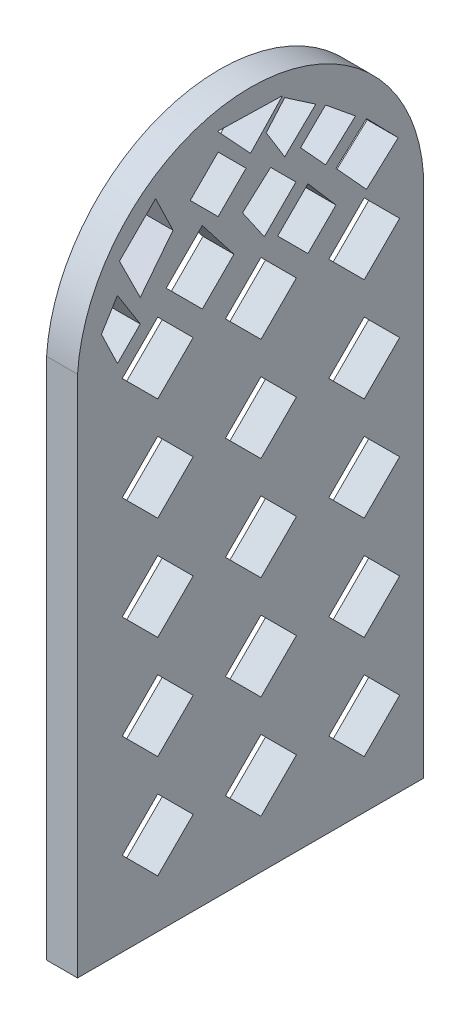
from build123d import *

# Parameters (mm, degrees)
MAINBASESKETCH_W                 = 7.9
MAINBASESKETCH_H                 = 3.2
MAINBASEEXTRUDE_DEPTH            = 7.9
MAINBASESHELL_T                  = -1.2
SLIMYELLOWUNDEREXT_START         = -0.2
SLIMYELLOWUNDEREXT_DEPTH         = 2
SLIMYELLLOWUPPERCIRCLESKETCH_R   = 2.45
SLIMYELLLOWUPPERCIRCLESKETCH_R_2 = 2
SLIMYELLOWUPPERCIRCLE_DEPTH      = 1.6
MOVE_START                       = 3.2
MOVE_FACE2_OUTLINE_W             = 7.9
MOVE_FACE2_OUTLINE_H             = 15.8
MOVE_FACE2_OUTLINE_R             = 2
MOVE_FACE2_DEPTH                 = 27.8
MOVE_START_2                     = 31
MOVE_FACE2_2_OUTLINE_R           = 2.45
MOVE_FACE2_2_OUTLINE_R_2         = 2
MOVE_FACE2_2_DEPTH               = 1.6
FILLET25_R                       = 7.6
FILLET26_R                       = 7.6
CUT_EXTRUDE55_DEPTH              = 35.461282763
CUT_EXTRUDE57_REACH              = 34.748
SKETCH160_R                      = 0.75
BOSS_EXTRUDE20_DEPTH             = 3.5
BOSS_EXTRUDE22_DEPTH             = 1.2
CUT_EXTRUDE58_DEPTH              = 35.461282763
CUT_EXTRUDE59_DEPTH              = 31.506685799
CUT_EXTRUDE61_DEPTH              = 31.506685799
LPATTERN5_COUNT                  = 5
LPATTERN5_PITCH                  = 4
LPATTERN5_COUNT_DIR2             = 3
LPATTERN5_PITCH_DIR2             = 4
CUT_EXTRUDE62_DEPTH              = 31.506685799


# Read off the part's stored shape, not the designer's step: Move Face2
with BuildPart() as part:
    # MainBaseSketch → MainBaseExtrude (new, symmetric)
    with BuildSketch(Plane.XY):
        with Locations((4.631967213, 1.6)):
            Rectangle(MAINBASESKETCH_W, MAINBASESKETCH_H)
    extrude(amount=MAINBASEEXTRUDE_DEPTH, both=True)

    # MainBaseShell
    mainbaseshell_openings = [part.faces().sort_by_distance(p)[0] for p in [
        (4.631967213, 0, 0),
    ]]
    offset(amount=MAINBASESHELL_T, openings=mainbaseshell_openings, kind=Kind.INTERSECTION)

    # SlimYellowUnderExtSketch → SlimYellowUnderExt (add)
    with BuildSketch(Plane.XZ.offset(-2).offset(SLIMYELLOWUNDEREXT_START)):
        Polygon((1.881967213, 1.952811318), (1.881967213, 2.947188682), (2.384104441, 2.947188682), (2.882626102, 2.45), (2.384104441, 1.952811318), align=None)
        Polygon((6.381308324, 2.45), (6.879829986, 2.947188682), (7.381967213, 2.947188682), (7.381967213, 1.952811318), (6.879829986, 1.952811318), align=None)
        Polygon((1.881967213, -1.952811318), (2.384104441, -1.952811318), (2.882626102, -2.45), (2.384104441, -2.947188682), (1.881967213, -2.947188682), align=None)
        Polygon((7.381967213, -1.952811318), (7.381967213, -2.947188682), (6.879829986, -2.947188682), (6.381308324, -2.45), (6.879829986, -1.952811318), align=None)
    extrude(amount=SLIMYELLOWUNDEREXT_DEPTH)

    # SlimYelllowUpperCircleSketch → SlimYellowUpperCircle (add)
    with BuildSketch(Plane(origin=(0, 3.2, 0), x_dir=(1, 0, 0), z_dir=(0, 1, 0))):
        with Locations((4.647335619, 0)):
            Circle(SLIMYELLLOWUPPERCIRCLESKETCH_R)
        with Locations(Location((4.647335619, 0, 0), (0, 0, 270))):
            Circle(SLIMYELLLOWUPPERCIRCLESKETCH_R_2, mode=Mode.SUBTRACT)
    extrude(amount=SLIMYELLOWUPPERCIRCLE_DEPTH)

    # Move Face2 outline → Move Face2 (add)
    with BuildSketch(Plane(origin=(0, 0, 0), x_dir=(1, 0, 0), z_dir=(0, 1, 0)).offset(MOVE_START)):
        with Locations((4.631967213, 0)):
            Rectangle(MOVE_FACE2_OUTLINE_W, MOVE_FACE2_OUTLINE_H)
        with Locations((4.647335619, 0)):
            Circle(MOVE_FACE2_OUTLINE_R, mode=Mode.SUBTRACT)
    extrude(amount=MOVE_FACE2_DEPTH)

    # Move Face2 2 outline → Move Face2 2 (add)
    with BuildSketch(Plane(origin=(0, 0, 0), x_dir=(1, 0, 0), z_dir=(0, 1, 0)).offset(MOVE_START_2)):
        with Locations((4.647335619, 0)):
            Circle(MOVE_FACE2_2_OUTLINE_R)
        with Locations((4.647335619, 0)):
            Circle(MOVE_FACE2_2_OUTLINE_R_2, mode=Mode.SUBTRACT)
    extrude(amount=MOVE_FACE2_2_DEPTH)

    # Fillet25
    # the kernel refuses this fillet: 7.6 mm, written as the material it takes off along each edge
    with BuildSketch(Plane(origin=(0.681967213, 31, 7.9), x_dir=(0, 0, -1), z_dir=(1, 0, 0))) as fillet25_piece_1_section:
        with BuildLine():
            CenterArc((FILLET25_R, -FILLET25_R), FILLET25_R, 90, 90)
            Line((0, -FILLET25_R), (-FILLET25_R * 0.02, -FILLET25_R))
            Line((-FILLET25_R * 0.02, -FILLET25_R), (-FILLET25_R * 0.02, FILLET25_R * 0.02))
            Line((-FILLET25_R * 0.02, FILLET25_R * 0.02), (FILLET25_R, FILLET25_R * 0.02))
            Line((FILLET25_R, FILLET25_R * 0.02), (FILLET25_R, 0))
        make_face()
    fillet25_piece_1 = extrude(amount=7.9, mode=Mode.PRIVATE)
    fillet25_piece_1 = fillet25_piece_1 - Plane(origin=(4.647335619, 29.251763141, 0), x_dir=(1, 0, 0), z_dir=(0, -1, 0)) * Cylinder(2.45, 47, mode=Mode.PRIVATE)
    add(fillet25_piece_1, mode=Mode.SUBTRACT)

    # Fillet26
    # the kernel refuses this fillet: 7.6 mm, written as the material it takes off along each edge
    with BuildSketch(Plane(origin=(27.581967213, 31, -7.9), x_dir=(0, 0, 1), z_dir=(-1, 0, 0))) as fillet26_piece_1_section:
        with BuildLine():
            CenterArc((FILLET26_R, -FILLET26_R), FILLET26_R, 90, 90)
            Line((0, -FILLET26_R), (0, 0))
            Line((0, 0), (FILLET26_R, 0))
        make_face()
    fillet26_piece_1 = extrude(amount=45.9, mode=Mode.PRIVATE)
    fillet26_piece_1 = fillet26_piece_1 - Plane(origin=(4.647335619, 29.29236393, 0), x_dir=(1, 0, 0), z_dir=(0, -1, 0)) * Cylinder(2.45, 123, mode=Mode.PRIVATE)
    add(fillet26_piece_1, mode=Mode.SUBTRACT)

    # Sketch159 → Cut-Extrude55 (cut, through all)
    with BuildSketch(Plane(origin=(8.581967213, 0, 0), x_dir=(0, 0, -1), z_dir=(1, 0, 0))):
        with BuildLine():
            Line((6.7, 3.204620212), (6.7, 23.463811934))
            ThreePointArc((6.7, 23.463811934), (0, 29.737650856), (-6.7, 23.463811934))
            Line((-6.7, 23.463811934), (-6.7, 3.204620212))
            Line((-6.7, 3.204620212), (6.7, 3.204620212))
        make_face()
    extrude(amount=-CUT_EXTRUDE55_DEPTH, mode=Mode.SUBTRACT)

    # Sketch160 → Cut-Extrude57 (cut, up to next)
    with BuildSketch(Plane(origin=(0, 2, 0), x_dir=(-1, 0, 0), z_dir=(0, -1, 0)), mode=Mode.PRIVATE) as cut_extrude57_sk1:
        with Locations(Location((-6.381967213, 0, 0), (0, 0, 180))):
            Circle(SKETCH160_R)
    cut_extrude57_tool1 = extrude(cut_extrude57_sk1.sketch, amount=-CUT_EXTRUDE57_REACH, mode=Mode.PRIVATE) & part.part
    # Sketch160 → Cut-Extrude57 (cut, up to next)
    with BuildSketch(Plane(origin=(0, 2, 0), x_dir=(-1, 0, 0), z_dir=(0, -1, 0)), mode=Mode.PRIVATE) as cut_extrude57_sk2:
        with Locations(Location((-2.881967213, 0, 0), (0, 0, 180))):
            Circle(SKETCH160_R)
    cut_extrude57_tool2 = extrude(cut_extrude57_sk2.sketch, amount=-CUT_EXTRUDE57_REACH, mode=Mode.PRIVATE) & part.part
    add(cut_extrude57_tool1.solids().sort_by_distance((6.381967, 2, 0))[0], mode=Mode.SUBTRACT)
    add(cut_extrude57_tool2.solids().sort_by_distance((2.881967, 2, 0))[0], mode=Mode.SUBTRACT)

    # Sketch161 → Boss-Extrude20 (add, symmetric)
    with BuildSketch(Plane(origin=(4.631967213, 0, 0), x_dir=(0, 0, -1), z_dir=(1, 0, 0))):
        with BuildLine():
            Line((2.455062292, 30.688052313), (2.455062292, 30.469179439))
            Line((2.455062292, 30.469179439), (2.455062292, 29.272723248))
            ThreePointArc((2.455062292, 29.272723248), (0, 29.737650856), (-2.455062292, 29.272723248))
            Line((-2.455062292, 29.272723248), (-2.455062292, 30.526922148))
            Line((-2.455062292, 30.526922148), (-2.455062292, 30.688052313))
            ThreePointArc((-2.455062292, 30.688052313), (0, 31.033009473), (2.455062292, 30.688052313))
        make_face()
    extrude(amount=BOSS_EXTRUDE20_DEPTH, both=True)

    # Sketch163 → Cut-Extrude58 (cut, through all)
    with BuildSketch(Plane.ZY.offset(-0.681967213)):
        with BuildLine():
            Line((-7.9, 23.4), (-7.9, 0))
            Line((-7.9, 0), (7.9, 0))
            Line((7.9, 0), (7.9, 23.4))
            ThreePointArc((7.9, 23.4), (6.393942446, 28.039773701), (2.45, 30.91049266))
            Line((2.45, 30.91049266), (2.514245173, 32.885555996))
            Line((2.514245173, 32.885555996), (-2.45, 32.885555996))
            Line((-2.45, 32.885555996), (-2.45, 30.91049266))
            ThreePointArc((-2.45, 30.91049266), (-6.393942446, 28.039773701), (-7.9, 23.4))
        make_face()
        with BuildLine():
            Line((6.7, 23.463811934), (6.7, 3.204620212))
            Line((6.7, 3.204620212), (-6.7, 3.204620212))
            Line((-6.7, 3.204620212), (-6.7, 23.463811934))
            ThreePointArc((-6.7, 23.463811934), (0, 29.737650856), (6.7, 23.463811934))
        make_face(mode=Mode.SUBTRACT)
    extrude(amount=-CUT_EXTRUDE58_DEPTH, mode=Mode.SUBTRACT)


with BuildPart() as body_2:
    # Sketch162 → Boss-Extrude22 (new body)
    with BuildSketch(Plane.ZY.offset(-0.681967213)):
        with BuildLine():
            Line((-6.7, 3.204620212), (-6.7, 23.463811934))
            ThreePointArc((-6.7, 23.463811934), (0, 29.737650856), (6.7, 23.463811934))
            Line((6.7, 23.463811934), (6.7, 3.204620212))
            Line((6.7, 3.204620212), (-6.7, 3.204620212))
        make_face()
    extrude(amount=BOSS_EXTRUDE22_DEPTH)

    # Sketch164 → Cut-Extrude59 (cut, through all)
    with BuildSketch(Plane.ZY.offset(-0.681967213)):
        Polygon((0, 27.521885921), (-1.241361972, 28.838648646), (1.278746144, 28.898801022), align=None)
    extrude(amount=CUT_EXTRUDE59_DEPTH, mode=Mode.SUBTRACT)

    # Sketch165 → Cut-Extrude61 (cut, through all)
    with BuildSketch(Plane.ZY.offset(-0.681967213)):
        Polygon((-4.405546645, 23.827298552), (-3.03141738, 22.453169286), (-4.405546645, 21.079040021), (-5.779675911, 22.453169286), align=None)
    cut_extrude61 = extrude(amount=CUT_EXTRUDE61_DEPTH, mode=Mode.SUBTRACT)

    # LPattern5: Cut-Extrude61 5 × 3
    with Locations(*[(0, -i * LPATTERN5_PITCH, j * LPATTERN5_PITCH_DIR2) for i in range(LPATTERN5_COUNT) for j in range(LPATTERN5_COUNT_DIR2) if (i, j) != (0, 0)]):
        add(cut_extrude61, mode=Mode.SUBTRACT)

    # Sketch166 → Cut-Extrude62 (cut, through all)
    with BuildSketch(Plane.ZY.offset(-0.681967213)):
        Polygon((-4.494877975, 24.067352963), (-5.720341085, 25.188203369), (-4.494877975, 26.443555824), (-3.311490851, 25.361189552), align=None)
        Polygon((-4.06895482, 26.742449265), (-2.909533146, 25.682002612), (-1.939612427, 26.742449265), (-2.909533146, 27.689276634), align=None)
        Polygon((-2.529653596, 27.908133687), (-1.326607494, 26.742449265), (-0.609263234, 27.908133687), (-1.326607494, 28.730090652), align=None)
        Polygon((-3.311490851, 24.134603988), (-2.225644972, 23.048758109), (-1.053867228, 24.220535852), (-2.225644972, 25.392313595), align=None)
        Polygon((-1.760283975, 25.682002612), (-0.536126237, 24.457844874), (0.311285226, 25.682002612), (-0.781045381, 26.661241207), align=None)
        Polygon((0.640575983, 24.457844874), (1.865804986, 23.232615872), (3.266618207, 24.633429093), (1.865804986, 26.034242315), align=None)
        Polygon((0.170877374, 27.11002176), (1.253190484, 26.027708649), (2.335503595, 27.11002176), (1.253190484, 28.19233487), align=None)
        Polygon((3.001969531, 26.443555824), (4.270065236, 24.825578524), (5.076744937, 26.443555824), (3.675931716, 27.844369045), align=None)
        Polygon((4.270065236, 23.933022483), (5.15432961, 23.048758109), (5.775380406, 24.339596358), (5.15432961, 25.333835704), align=None)
    extrude(amount=CUT_EXTRUDE62_DEPTH, mode=Mode.SUBTRACT)


solid = body_2.part
